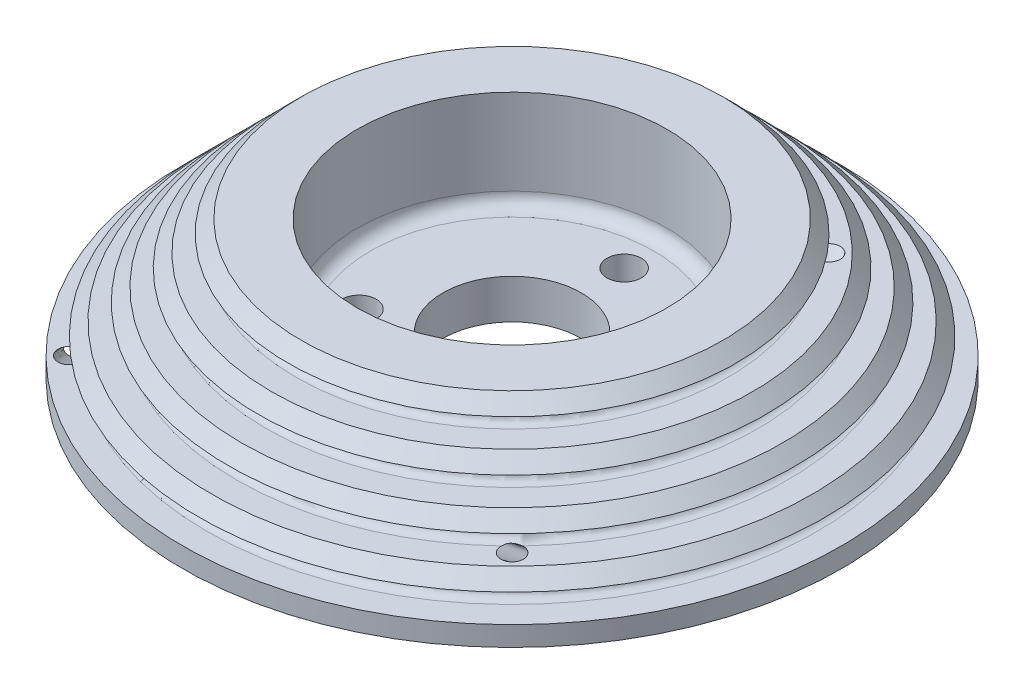
from build123d import *

# Parameters (mm, degrees)
FILLET1_R          = 1.25
SKETCH13_R         = 23.5
CUT_EXTRUDE2_DEPTH = 15
SKETCH14_R         = 2.6
SKETCH14_R_2       = 10.5
CUT_EXTRUDE3_DEPTH = 73.284161474
FILLET2_R          = 2
SKETCH8_R          = 1.7
SKETCH11_R         = 1.7
SKETCH10_R         = 1.7
SKETCH9_R          = 1.7


with BuildPart() as part:
    # Sketch1 → Revolve1 (revolve)
    with BuildSketch(Plane.XY, mode=Mode.PRIVATE) as revolve1_sk:
        Polygon((0, 0), (0, 21), (-32, 21), (-50, 3), (-50, 0), align=None)
    revolve(revolve1_sk.sketch.rotate(Axis((0, 0, 0), (0, 1, 0)), 270), axis=Axis((0, 0, 0), (0, 1, 0)))

    # Sketch2 → Cut-Revolve1 (revolve, cut)
    with BuildSketch(Plane.XY, mode=Mode.PRIVATE) as cut_revolve1_sk:
        Polygon((-45, 5.5), (-47.5, 5.5), (-50, 3), (-45, 3), align=None)
        Polygon((-31.5, 19), (-34, 19), (-36.5, 16.5), (-31.5, 16.5), align=None)
        Polygon((-40.5, 10), (-43, 10), (-45.5, 7.5), (-40.5, 7.5), align=None)
        Polygon((-36, 14.5), (-38.5, 14.5), (-41, 12), (-36, 12), align=None)
    revolve(cut_revolve1_sk.sketch.rotate(Axis((0, 0, 0), (0, 1, 0)), 270), axis=Axis((0, 0, 0), (0, 1, 0)), mode=Mode.SUBTRACT)

    # Fillet1
    fillet1_edges = [part.edges().sort_by_distance(p)[0] for p in [
        (0, 5.5, 45),
        (0, 3, 45),
        (0, 12, 36),
        (0, 14.5, 36),
        (0, 7.5, 40.5),
        (0, 10, 40.5),
        (0, 19, 31.5),
        (0, 16.5, 31.5),
    ]]
    fillet(fillet1_edges, radius=FILLET1_R - 0.0001)  # a hair under: the kernel refuses the full size

    # Sketch13 → Cut-Extrude2 (cut)
    with BuildSketch(Plane(origin=(0, 21, 0), x_dir=(1, 0, 0), z_dir=(0, 1, 0))):
        with Locations(Location((0, 0, 0), (0, 0, 270))):
            Circle(SKETCH13_R)
    extrude(amount=-CUT_EXTRUDE2_DEPTH, mode=Mode.SUBTRACT)

    # Sketch14 → Cut-Extrude3 (cut, through all)
    with BuildSketch(Plane(origin=(0, 6, 0), x_dir=(1, 0, 0), z_dir=(0, 1, 0))):
        with Locations(Location((0, 17, 0), (0, 0, 270))):
            Circle(SKETCH14_R)
        with Locations(Location((-14.722431864, -8.5, 0), (0, 0, 270))):
            Circle(SKETCH14_R)
        with Locations(Location((0, 0, 0), (0, 0, 270))):
            Circle(SKETCH14_R_2)
        with Locations(Location((14.722431864, -8.5, 0), (0, 0, 270))):
            Circle(SKETCH14_R)
    extrude(amount=-CUT_EXTRUDE3_DEPTH, mode=Mode.SUBTRACT)

    # Fillet2
    fillet2_edges = [part.edges().sort_by_distance(p)[0] for p in [
        (0, 6, -23.5),
    ]]
    fillet(fillet2_edges, radius=FILLET2_R)

    # Cut-Sweep6: sweep along a path in Sketch15
    with BuildLine(Plane(origin=(21.321467403, -5.316806558, -21.321467403), x_dir=(-0.12278780396897587, -0.9848077530122072, 0.12278780396897629), z_dir=(-0.6963642403200171, 0.17364817766693497, 0.6963642403200199))) as cut_sweep6_path:
        Line((26.023947683, 83.445555011), (-22.153365965, 0))
        Line((-22.153365965, 0), (-23.336643221, -2.049496326))
    # Sketch8 → Cut-Sweep6 (sweep, cut)
    with BuildSketch(Plane(origin=(0, 16.5, 0), x_dir=(1, 0, 0), z_dir=(0, 1, 0))):
        with Locations((24.04163056, 24.04163056)):
            Circle(SKETCH8_R)
    sweep(path=cut_sweep6_path.line, mode=Mode.SUBTRACT)

    # Cut-Sweep7: sweep along a path in Sketch16
    with BuildLine(Plane(origin=(-21.311936665, -10.969928145, -21.311936665), x_dir=(0.24184476264797308, -0.9396926207859093, 0.24184476264797392), z_dir=(-0.6644630243886742, -0.34202014332566627, -0.6644630243886765))) as cut_sweep7_path:
        Line((29.426465731, 93.306534305), (-24.444086967, 0))
        Line((-24.444086967, 0), (-25.277416507, -1.443369103))
    # Sketch11 → Cut-Sweep7 (sweep, cut)
    with BuildSketch(Plane(origin=(0, 12, 0), x_dir=(1, 0, 0), z_dir=(0, 1, 0))):
        with Locations((-27.223611076, 27.223611076)):
            Circle(SKETCH11_R)
    sweep(path=cut_sweep7_path.line, mode=Mode.SUBTRACT)

    # Cut-Sweep8: sweep along a path in Sketch17
    with BuildLine(Plane(origin=(-28.977268915, -14.915517198, 28.977268915), x_dir=(0.2418447626479711, -0.9396926207859105, -0.2418447626479711), z_dir=(-0.664463024388675, -0.3420201433256629, 0.6644630243886775))) as cut_sweep8_path:
        Line((30.650286591, -86.109913563), (-19.065295184, 0))
        Line((-19.065295184, 0), (-20.205011582, 1.974046707))
    # Sketch10 → Cut-Sweep8 (sweep, cut)
    with BuildSketch(Plane(origin=(0, 3, 0), x_dir=(1, 0, 0), z_dir=(0, 1, 0))):
        with Locations((-33.588110704, -33.588110704)):
            Circle(SKETCH10_R)
    sweep(path=cut_sweep8_path.line, mode=Mode.SUBTRACT)

    # Cut-Sweep9: sweep along a path in Sketch18
    with BuildLine(Plane(origin=(25.144364993, -12.94260027, 25.144364993), x_dir=(-0.24184476264797813, -0.9396926207859068, -0.241844762647979), z_dir=(-0.6644630243886723, 0.34202014332567343, -0.6644630243886749))) as cut_sweep9_path:
        Line((32.407935036, -93.812194686), (-21.754560819, 0))
        Line((-21.754560819, 0), (-22.536808538, 1.354892793))
    # Sketch9 → Cut-Sweep9 (sweep, cut)
    with BuildSketch(Plane(origin=(0, 7.5, 0), x_dir=(1, 0, 0), z_dir=(0, 1, 0))):
        with Locations((30.405591591, -30.405591591)):
            Circle(SKETCH9_R)
    sweep(path=cut_sweep9_path.line, mode=Mode.SUBTRACT)


solid = part.part
